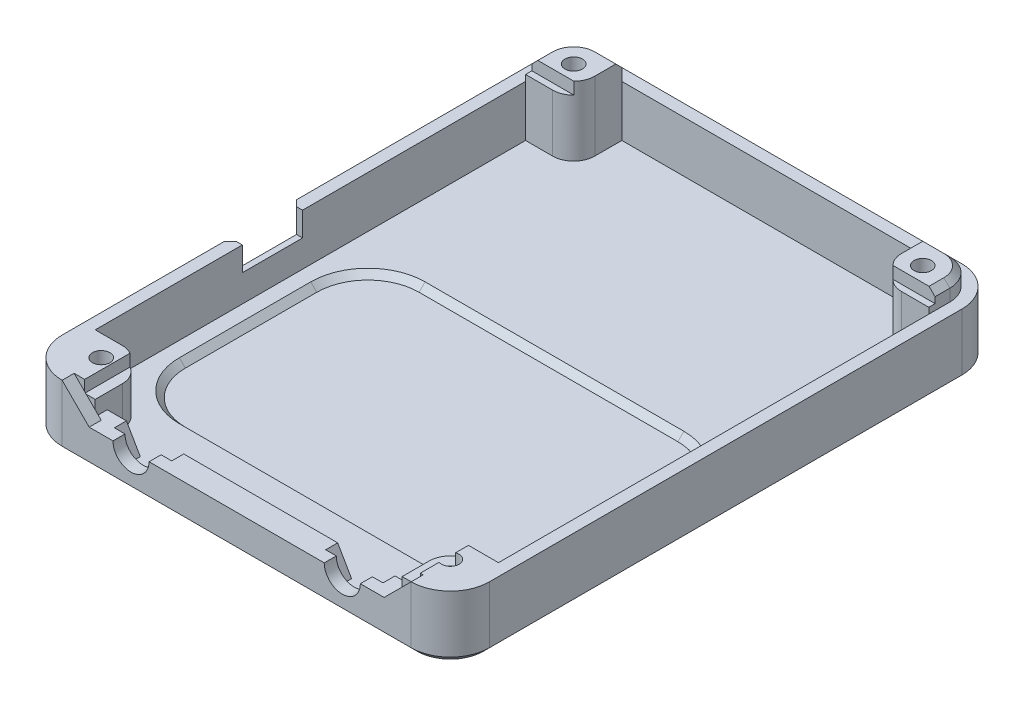
from build123d import *

# Parameters (mm, degrees)
BOSS_EXTRUDE1_DEPTH                                = 10.5
BOSS_EXTRUDE2_DEPTH                                = 2
BOSS_EXTRUDE4_DEPTH                                = 11.5
BOSS_EXTRUDE6_DEPTH                                = 8.5
CUT_EXTRUDE1_DEPTH                                 = 2
CUT_EXTRUDE2_REACH                                 = 89.912
SKETCH9_W                                          = 10
SKETCH9_H                                          = 4
CHAMFER1_SIZE                                      = 1
CHAMFER2_SIZE                                      = 1
CBORE_FOR_M2_5_PAN_HEAD_MACHINE_SCREW1_D           = 2.9
CBORE_FOR_M2_5_PAN_HEAD_MACHINE_SCREW1_CBORE_D     = 6
CBORE_FOR_M2_5_PAN_HEAD_MACHINE_SCREW1_CBORE_DEPTH = 2.1
CBORE_FOR_M2_5_PAN_HEAD_MACHINE_SCREW2_D           = 2.9
CBORE_FOR_M2_5_PAN_HEAD_MACHINE_SCREW2_CBORE_D     = 6
CBORE_FOR_M2_5_PAN_HEAD_MACHINE_SCREW2_CBORE_DEPTH = 2.1
CBORE_FOR_M2_5_PAN_HEAD_MACHINE_SCREW3_D           = 2.9
CBORE_FOR_M2_5_PAN_HEAD_MACHINE_SCREW3_CBORE_D     = 6
CBORE_FOR_M2_5_PAN_HEAD_MACHINE_SCREW3_CBORE_DEPTH = 2.1
CBORE_FOR_M2_5_PAN_HEAD_MACHINE_SCREW4_D           = 2.9
CBORE_FOR_M2_5_PAN_HEAD_MACHINE_SCREW4_CBORE_D     = 6
CBORE_FOR_M2_5_PAN_HEAD_MACHINE_SCREW4_CBORE_DEPTH = 2.1
SKETCH18_W                                         = 55.765913406
SKETCH18_H                                         = 7.966361229
CUT_EXTRUDE3_DEPTH                                 = 2
BOSS_EXTRUDE7_DEPTH                                = 2
SKETCH21_W                                         = 67
SKETCH21_H                                         = 1.043656047
CUT_EXTRUDE4_DEPTH                                 = 2
CUT_EXTRUDE5_DEPTH                                 = 1
CHAMFER4_SIZE                                      = 1.5
CHAMFER5_SIZE                                      = 1
CHAMFER6_SIZE                                      = 1


with BuildPart() as part:
    # Sketch2 → Boss-Extrude1 (new body)
    with BuildSketch(Plane(origin=(0, 0, 0), x_dir=(1, 0, 0), z_dir=(0, 1, 0))):
        with BuildLine():
            Line((-30.346153846, 41.446848386), (27.653846154, 41.446848386))
            ThreePointArc((27.653846154, 41.446848386), (32.250040232, 39.543042463), (34.153846154, 34.946848386))
            Line((34.153846154, 34.946848386), (34.153846154, -43.553151614))
            ThreePointArc((34.153846154, -43.553151614), (32.250040232, -48.149345692), (27.653846154, -50.053151614))
            Line((27.653846154, -50.053151614), (-30.346153846, -50.053151614))
            ThreePointArc((-30.346153846, -50.053151614), (-34.942347924, -48.149345692), (-36.846153846, -43.553151614))
            Line((-36.846153846, -43.553151614), (-36.846153846, 34.946848386))
            ThreePointArc((-36.846153846, 34.946848386), (-34.942347924, 39.543042463), (-30.346153846, 41.446848386))
        make_face()
        with BuildLine():
            Line((-30.346153846, 39.446848386), (27.653846154, 39.446848386))
            ThreePointArc((27.653846154, 39.446848386), (30.835826669, 38.128828901), (32.153846154, 34.946848386))
            Line((32.153846154, 34.946848386), (32.153846154, -43.553151614))
            ThreePointArc((32.153846154, -43.553151614), (30.835826669, -46.73513213), (27.653846154, -48.053151614))
            Line((27.653846154, -48.053151614), (-30.346153846, -48.053151614))
            ThreePointArc((-30.346153846, -48.053151614), (-33.528134361, -46.73513213), (-34.846153846, -43.553151614))
            Line((-34.846153846, -43.553151614), (-34.846153846, 34.946848386))
            ThreePointArc((-34.846153846, 34.946848386), (-33.528134361, 38.128828901), (-30.346153846, 39.446848386))
        make_face(mode=Mode.SUBTRACT)
    extrude(amount=BOSS_EXTRUDE1_DEPTH)

    # Sketch3 → Boss-Extrude2 (add)
    with BuildSketch(Plane(origin=(0, 0, 0), x_dir=(1, 0, 0), z_dir=(0, 1, 0))):
        with BuildLine():
            Line((-30.346153846, -48.053151614), (27.653846154, -48.053151614))
            ThreePointArc((27.653846154, -48.053151614), (30.835826669, -46.73513213), (32.153846154, -43.553151614))
            Line((32.153846154, -43.553151614), (32.153846154, 34.946848386))
            ThreePointArc((32.153846154, 34.946848386), (30.835826669, 38.128828901), (27.653846154, 39.446848386))
            Line((27.653846154, 39.446848386), (-30.346153846, 39.446848386))
            ThreePointArc((-30.346153846, 39.446848386), (-33.528134361, 38.128828901), (-34.846153846, 34.946848386))
            Line((-34.846153846, 34.946848386), (-34.846153846, -43.553151614))
            ThreePointArc((-34.846153846, -43.553151614), (-33.528134361, -46.73513213), (-30.346153846, -48.053151614))
        make_face()
    extrude(amount=BOSS_EXTRUDE2_DEPTH)

    # Sketch6 → Boss-Extrude4 (add)
    with BuildSketch(Plane(origin=(0, 2, 0), x_dir=(1, 0, 0), z_dir=(0, 1, 0))):
        with BuildLine():
            Line((-26.846153846, 34.946848386), (-26.846153846, 39.446848386))
            Line((-26.846153846, 39.446848386), (-30.346153846, 39.446848386))
            ThreePointArc((-30.346153846, 39.446848386), (-33.528134361, 38.128828901), (-34.846153846, 34.946848386))
            Line((-34.846153846, 34.946848386), (-34.846153846, 31.446848386))
            Line((-34.846153846, 31.446848386), (-30.346153846, 31.446848386))
            ThreePointArc((-30.346153846, 31.446848386), (-27.871280112, 32.471974652), (-26.846153846, 34.946848386))
        make_face()
        with BuildLine():
            Line((24.153846154, 34.946848386), (24.153846154, 39.446848386))
            Line((24.153846154, 39.446848386), (27.653846154, 39.446848386))
            ThreePointArc((27.653846154, 39.446848386), (30.835826669, 38.128828901), (32.153846154, 34.946848386))
            Line((32.153846154, 34.946848386), (32.153846154, 31.446848386))
            Line((32.153846154, 31.446848386), (27.653846154, 31.446848386))
            ThreePointArc((27.653846154, 31.446848386), (25.17897242, 32.471974652), (24.153846154, 34.946848386))
        make_face()
    extrude(amount=BOSS_EXTRUDE4_DEPTH)

    # Sketch8 → Boss-Extrude6 (add)
    with BuildSketch(Plane(origin=(0, 2, 0), x_dir=(1, 0, 0), z_dir=(0, 1, 0))):
        with BuildLine():
            Line((32.153846154, -40.053151614), (32.153846154, -43.553151614))
            ThreePointArc((32.153846154, -43.553151614), (30.835826669, -46.73513213), (27.653846154, -48.053151614))
            Line((27.653846154, -48.053151614), (24.153846154, -48.053151614))
            Line((24.153846154, -48.053151614), (24.153846154, -43.553151614))
            ThreePointArc((24.153846154, -43.553151614), (25.17897242, -41.07827788), (27.653846154, -40.053151614))
            Line((27.653846154, -40.053151614), (32.153846154, -40.053151614))
        make_face()
        with BuildLine():
            Line((-34.846153846, -40.053151614), (-34.846153846, -43.553151614))
            ThreePointArc((-34.846153846, -43.553151614), (-33.528134361, -46.73513213), (-30.346153846, -48.053151614))
            Line((-30.346153846, -48.053151614), (-26.846153846, -48.053151614))
            Line((-26.846153846, -48.053151614), (-26.846153846, -43.553151614))
            ThreePointArc((-26.846153846, -43.553151614), (-27.871280112, -41.07827788), (-30.346153846, -40.053151614))
            Line((-30.346153846, -40.053151614), (-34.846153846, -40.053151614))
        make_face()
    extrude(amount=BOSS_EXTRUDE6_DEPTH)

    # Sketch7 → Cut-Extrude1 (cut)
    with BuildSketch(Plane.XY.offset(50.053151614)):
        with BuildLine():
            Line((27.653846154, 10.5), (-30.346153846, 10.5))
            Line((-30.346153846, 10.5), (-25.846153846, 6))
            Line((-25.846153846, 6), (-21.89693017, 6))
            ThreePointArc((-21.89693017, 6), (-18.89693017, 3), (-15.89693017, 6))
            Line((-15.89693017, 6), (13.204622477, 6))
            ThreePointArc((13.204622477, 6), (16.204622477, 3), (19.204622477, 6))
            Line((19.204622477, 6), (23.153846154, 6))
            Line((23.153846154, 6), (27.653846154, 10.5))
        make_face()
    extrude(amount=-CUT_EXTRUDE1_DEPTH, mode=Mode.SUBTRACT)

    # Sketch9 → Cut-Extrude2 (cut, up to next)
    with BuildSketch(Plane.ZY.offset(36.846153846), mode=Mode.PRIVATE) as cut_extrude2_sk1:
        with Locations((10.611298715, 8.5)):
            Rectangle(SKETCH9_W, SKETCH9_H)
    cut_extrude2_tool1 = extrude(cut_extrude2_sk1.sketch, amount=-CUT_EXTRUDE2_REACH, mode=Mode.PRIVATE) & part.part
    add(cut_extrude2_tool1.solids().sort_by_distance((-36.846154, 8.5, 10.611299))[0], mode=Mode.SUBTRACT)

    # Chamfer1
    chamfer1_edges = [part.edges().sort_by_distance(p)[0] for p in [
        (-36.846153846, 8.5, 5.611298715),
        (-36.846153846, 6.5, 10.611298715),
        (-36.846153846, 8.5, 15.611298715),
    ]]
    chamfer(chamfer1_edges, length=CHAMFER1_SIZE)

    # Chamfer2
    chamfer2_edges = [part.edges().sort_by_distance(p)[0] for p in [
        (-36.846153846, 0, 4.303151614),
        (-34.942347924, 0, -39.543042463),
        (-1.346153846, 0, -41.446848386),
        (32.250040232, 0, -39.543042463),
        (34.153846154, 0, 4.303151614),
        (32.250040232, 0, 48.149345692),
        (-1.346153846, 0, 50.053151614),
        (-34.942347924, 0, 48.149345692),
    ]]
    chamfer(chamfer2_edges, length=CHAMFER2_SIZE)

    # CBORE for M2.5 Pan Head Machine Screw1 (through all)
    with Locations(Plane(origin=(0, 0, 0), x_dir=(-1, 0, 0), z_dir=(0, -1, 0))):
        with Locations((-27.653846154, 34.946848386)):
            CounterBoreHole(CBORE_FOR_M2_5_PAN_HEAD_MACHINE_SCREW1_D / 2, CBORE_FOR_M2_5_PAN_HEAD_MACHINE_SCREW1_CBORE_D / 2, CBORE_FOR_M2_5_PAN_HEAD_MACHINE_SCREW1_CBORE_DEPTH)

    # CBORE for M2.5 Pan Head Machine Screw2 (through all)
    with Locations(Plane(origin=(0, 0, 0), x_dir=(-1, 0, 0), z_dir=(0, -1, 0))):
        with Locations((30.346153846, 34.946848386)):
            CounterBoreHole(CBORE_FOR_M2_5_PAN_HEAD_MACHINE_SCREW2_D / 2, CBORE_FOR_M2_5_PAN_HEAD_MACHINE_SCREW2_CBORE_D / 2, CBORE_FOR_M2_5_PAN_HEAD_MACHINE_SCREW2_CBORE_DEPTH)

    # CBORE for M2.5 Pan Head Machine Screw3 (through all)
    with Locations(Plane(origin=(0, 0, 0), x_dir=(-1, 0, 0), z_dir=(0, -1, 0))):
        with Locations((-27.653846154, -43.553151614)):
            CounterBoreHole(CBORE_FOR_M2_5_PAN_HEAD_MACHINE_SCREW3_D / 2, CBORE_FOR_M2_5_PAN_HEAD_MACHINE_SCREW3_CBORE_D / 2, CBORE_FOR_M2_5_PAN_HEAD_MACHINE_SCREW3_CBORE_DEPTH)

    # CBORE for M2.5 Pan Head Machine Screw4 (through all)
    with Locations(Plane(origin=(0, 0, 0), x_dir=(-1, 0, 0), z_dir=(0, -1, 0))):
        with Locations((30.346153846, -43.553151614)):
            CounterBoreHole(CBORE_FOR_M2_5_PAN_HEAD_MACHINE_SCREW4_D / 2, CBORE_FOR_M2_5_PAN_HEAD_MACHINE_SCREW4_CBORE_D / 2, CBORE_FOR_M2_5_PAN_HEAD_MACHINE_SCREW4_CBORE_DEPTH)

    # Sketch18 → Cut-Extrude3 (cut)
    with BuildSketch(Plane(origin=(0, 10.5, 0), x_dir=(1, 0, 0), z_dir=(0, 1, 0))):
        with Locations((-0.713197143, -44.069971)):
            Rectangle(SKETCH18_W, SKETCH18_H)
    extrude(amount=-CUT_EXTRUDE3_DEPTH, mode=Mode.SUBTRACT)

    # Sketch19 → Boss-Extrude7 (add)
    with BuildSketch(Plane(origin=(0, 0, 48.053151614), x_dir=(-1, 0, 0), z_dir=(0, 0, -1))):
        Polygon((-24.153846154, 2), (-18.659026224, 2), (-20.968427301, 6), (-21.953470486, 6), (-23.153846154, 6), (-24.153846154, 6), align=None)
        Polygon((-13.750218731, 2), (16.442526423, 2), (14.133125347, 6), (13.148082161, 6), (-10.455774469, 6), (-11.440817654, 6), align=None)
        Polygon((25.846153846, 6), (24.645778179, 6), (23.660734993, 6), (21.351333916, 2), (26.846153846, 2), (26.846153846, 6), align=None)
    extrude(amount=BOSS_EXTRUDE7_DEPTH)

    # Sketch21 → Cut-Extrude4 (cut)
    with BuildSketch(Plane(origin=(0, 13.5, 0), x_dir=(1, 0, 0), z_dir=(0, 1, 0))):
        with Locations((-1.346153846, 31.96867641)):
            Rectangle(SKETCH21_W, SKETCH21_H)
    extrude(amount=-CUT_EXTRUDE4_DEPTH, mode=Mode.SUBTRACT)

    # Sketch22 → Cut-Extrude5 (cut)
    with BuildSketch(Plane(origin=(0, 2, 0), x_dir=(1, 0, 0), z_dir=(0, 1, 0))):
        with BuildLine():
            Line((-22.846153846, 3.259423313), (20.153846154, 3.259423313))
            ThreePointArc((20.153846154, 3.259423313), (27.224913966, 0.330491125), (30.153846154, -6.740576687))
            Line((30.153846154, -6.740576687), (30.153846154, -28.568151594))
            ThreePointArc((30.153846154, -28.568151594), (27.224913966, -35.639219406), (20.153846154, -38.568151594))
            Line((20.153846154, -38.568151594), (-22.846153846, -38.568151594))
            ThreePointArc((-22.846153846, -38.568151594), (-29.917221658, -35.639219406), (-32.846153846, -28.568151594))
            Line((-32.846153846, -28.568151594), (-32.846153846, -6.740576687))
            ThreePointArc((-32.846153846, -6.740576687), (-29.917221658, 0.330491125), (-22.846153846, 3.259423313))
        make_face()
    extrude(amount=-CUT_EXTRUDE5_DEPTH, mode=Mode.SUBTRACT)

    # Chamfer4
    # the kernel refuses this chamfer: 1.5 mm, written as the material it adds along each edge
    with BuildSketch(Plane(origin=(20.153846154, 1, 38.568151594), x_dir=(0, 0.9996219169112968, 0.027495876610586775), z_dir=(-1, 0, 0))) as chamfer4_piece_1_section:
        Polygon((CHAMFER4_SIZE * 0.999621916911, CHAMFER4_SIZE * 0.0274958766106), (-CHAMFER4_SIZE * 0.0274958766106, CHAMFER4_SIZE * 0.999621916911), (0, 0), align=None)
    chamfer4_piece_1 = extrude(amount=43, mode=Mode.PRIVATE)
    chamfer4_piece_1 = split(chamfer4_piece_1, bisect_by=Plane(origin=(-1.346153846, 2, 38.022106092), z_dir=(0, -1, 0)), keep=Keep.TOP, mode=Mode.PRIVATE)
    add(chamfer4_piece_1)
    with BuildSketch(Plane(origin=(20.153846154, 1, 28.568151594), x_dir=(1, 0, 0), z_dir=(0, 0, -1))) as chamfer4_piece_2_section:
        Polygon((10, -CHAMFER4_SIZE), (10 - CHAMFER4_SIZE, 0), (10, 0), align=None)
    chamfer4_piece_2 = revolve(axis=Axis((20.153846154, 1, 28.568151594), (0, -1, 0)), revolution_arc=90, mode=Mode.PRIVATE)
    chamfer4_piece_2 = split(chamfer4_piece_2, bisect_by=Plane(origin=(26.515435334, 2, 34.929740774), z_dir=(0, -1, 0)), keep=Keep.TOP, mode=Mode.PRIVATE)
    add(chamfer4_piece_2)
    with BuildSketch(Plane(origin=(-22.846153846, 1, 28.568151594), x_dir=(0, 0, 1), z_dir=(1, 0, 0))) as chamfer4_piece_3_section:
        Polygon((10, -CHAMFER4_SIZE), (10 - CHAMFER4_SIZE, 0), (10, 0), align=None)
    chamfer4_piece_3 = revolve(axis=Axis((-22.846153846, 1, 28.568151594), (0, -1, 0)), revolution_arc=90, mode=Mode.PRIVATE)
    chamfer4_piece_3 = split(chamfer4_piece_3, bisect_by=Plane(origin=(-29.207743026, 2, 34.929740774), z_dir=(0, -1, 0)), keep=Keep.TOP, mode=Mode.PRIVATE)
    add(chamfer4_piece_3)
    with BuildSketch(Plane(origin=(30.153846154, 1, 6.740576687), x_dir=(0.027495876610586775, 0.9996219169112968, 0), z_dir=(0, 0, 1))) as chamfer4_piece_4_section:
        Polygon((CHAMFER4_SIZE * 0.999621916911, CHAMFER4_SIZE * 0.0274958766106), (-CHAMFER4_SIZE * 0.0274958766106, CHAMFER4_SIZE * 0.999621916911), (0, 0), align=None)
    chamfer4_piece_4 = extrude(amount=21.827574907, mode=Mode.PRIVATE)
    chamfer4_piece_4 = split(chamfer4_piece_4, bisect_by=Plane(origin=(29.607800651, 2, 17.654364141), z_dir=(0, -1, 0)), keep=Keep.TOP, mode=Mode.PRIVATE)
    add(chamfer4_piece_4)
    with BuildSketch(Plane(origin=(-32.846153846, 1, 28.568151594), x_dir=(-0.027495876610586775, 0.9996219169112968, 0), z_dir=(0, 0, -1))) as chamfer4_piece_5_section:
        Polygon((CHAMFER4_SIZE * 0.999621916911, CHAMFER4_SIZE * 0.0274958766106), (-CHAMFER4_SIZE * 0.0274958766106, CHAMFER4_SIZE * 0.999621916911), (0, 0), align=None)
    chamfer4_piece_5 = extrude(amount=21.827574907, mode=Mode.PRIVATE)
    chamfer4_piece_5 = split(chamfer4_piece_5, bisect_by=Plane(origin=(-32.300108344, 2, 17.654364141), z_dir=(0, -1, 0)), keep=Keep.TOP, mode=Mode.PRIVATE)
    add(chamfer4_piece_5)
    with BuildSketch(Plane(origin=(20.153846154, 1, 6.740576687), x_dir=(0, 0, -1), z_dir=(-1, 0, 0))) as chamfer4_piece_6_section:
        Polygon((10, -CHAMFER4_SIZE), (10 - CHAMFER4_SIZE, 0), (10, 0), align=None)
    chamfer4_piece_6 = revolve(axis=Axis((20.153846154, 1, 6.740576687), (0, -1, 0)), revolution_arc=90, mode=Mode.PRIVATE)
    chamfer4_piece_6 = split(chamfer4_piece_6, bisect_by=Plane(origin=(26.515435334, 2, 0.378987507), z_dir=(0, -1, 0)), keep=Keep.TOP, mode=Mode.PRIVATE)
    add(chamfer4_piece_6)
    with BuildSketch(Plane(origin=(-22.846153846, 1, 6.740576687), x_dir=(-1, 0, 0), z_dir=(0, 0, 1))) as chamfer4_piece_7_section:
        Polygon((10, -CHAMFER4_SIZE), (10 - CHAMFER4_SIZE, 0), (10, 0), align=None)
    chamfer4_piece_7 = revolve(axis=Axis((-22.846153846, 1, 6.740576687), (0, -1, 0)), revolution_arc=90, mode=Mode.PRIVATE)
    chamfer4_piece_7 = split(chamfer4_piece_7, bisect_by=Plane(origin=(-29.207743026, 2, 0.378987507), z_dir=(0, -1, 0)), keep=Keep.TOP, mode=Mode.PRIVATE)
    add(chamfer4_piece_7)
    with BuildSketch(Plane(origin=(-22.846153846, 1, -3.259423313), x_dir=(0, 0.9996219169112969, -0.02749587661058649), z_dir=(1, 0, 0))) as chamfer4_piece_8_section:
        Polygon((CHAMFER4_SIZE * 0.999621916911, CHAMFER4_SIZE * 0.0274958766106), (-CHAMFER4_SIZE * 0.0274958766106, CHAMFER4_SIZE * 0.999621916911), (0, 0), align=None)
    chamfer4_piece_8 = extrude(amount=43, mode=Mode.PRIVATE)
    chamfer4_piece_8 = split(chamfer4_piece_8, bisect_by=Plane(origin=(-1.346153846, 2, -2.713377811), z_dir=(0, -1, 0)), keep=Keep.TOP, mode=Mode.PRIVATE)
    add(chamfer4_piece_8)

    # Chamfer5
    chamfer5_edges = [part.edges().sort_by_distance(p)[0] for p in [
        (32.153846154, 13.5, -33.718676409),
        (30.835826669, 13.5, -38.128828901),
        (25.903846154, 13.5, -39.446848386),
    ]]
    chamfer(chamfer5_edges, length=CHAMFER5_SIZE)

    # Chamfer6
    chamfer6_edges = [part.edges().sort_by_distance(p)[0] for p in [
        (-28.596153846, 13.5, -39.446848386),
        (-33.528134361, 13.5, -38.128828901),
        (-34.846153846, 13.5, -33.718676409),
    ]]
    chamfer(chamfer6_edges, length=CHAMFER6_SIZE)


solid = part.part
